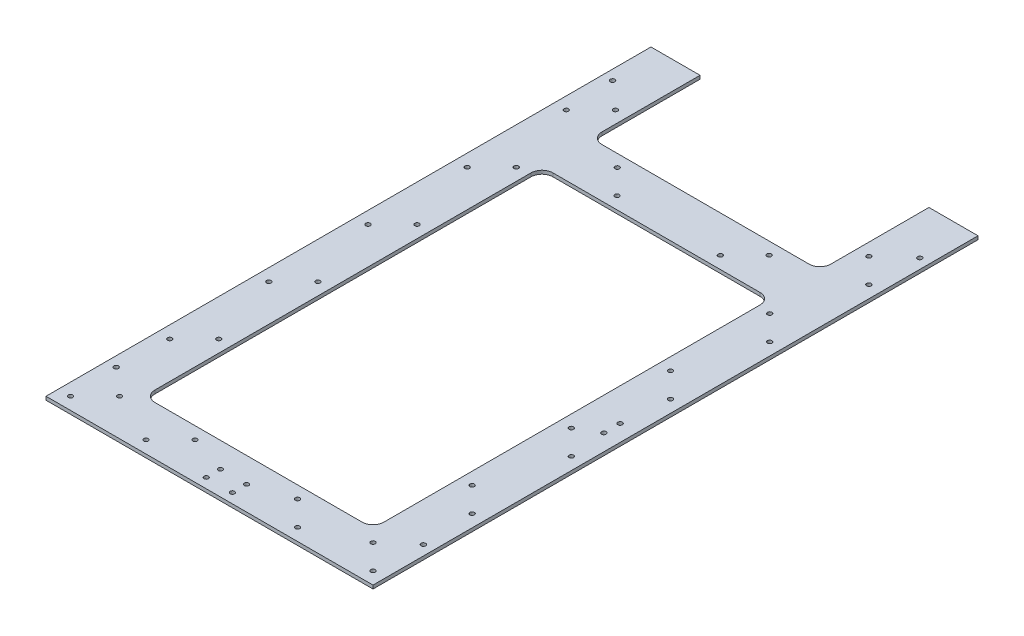
from build123d import *

# Parameters (mm, degrees)
SKETCH1_W           = 300
SKETCH1_H           = 600
BOSS_EXTRUDE1_DEPTH = 3.175
CUT_EXTRUDE1_DEPTH  = 10
SKETCH4_R           = 2.05
CUT_EXTRUDE2_DEPTH  = 51
SKETCH5_R           = 2.1
CUT_EXTRUDE3_DEPTH  = 67
SKETCH7_R           = 2.05
CUT_EXTRUDE4_DEPTH  = 10
SKETCH8_R           = 2.1
CUT_EXTRUDE5_DEPTH  = 10


with BuildPart() as part:
    # Sketch1 → Boss-Extrude1 (new body)
    with BuildSketch(Plane(origin=(0, 0, 0), x_dir=(1, 0, 0), z_dir=(0, 1, 0))):
        Rectangle(SKETCH1_W, SKETCH1_H)
    extrude(amount=BOSS_EXTRUDE1_DEPTH)

    # Sketch3 → Cut-Extrude1 (cut)
    with BuildSketch(Plane(origin=(0, 3.175, 0), x_dir=(1, 0, 0), z_dir=(0, 1, 0))):
        with BuildLine():
            Line((-95, -255), (95, -255))
            ThreePointArc((95, -255), (102.071067812, -252.071067812), (105, -245))
            Line((105, -245), (105, 100))
            ThreePointArc((105, 100), (102.071067812, 107.071067812), (95, 110))
            Line((95, 110), (-95, 110))
            ThreePointArc((-95, 110), (-102.071067812, 107.071067812), (-105, 100))
            Line((-105, 100), (-105, -245))
            ThreePointArc((-105, -245), (-102.071067812, -252.071067812), (-95, -255))
        make_face()
        with BuildLine():
            Line((105, 255), (105, 165))
            ThreePointArc((105, 165), (102.071067812, 157.928932188), (95, 155))
            Line((95, 155), (-95, 155))
            ThreePointArc((-95, 155), (-102.071067992, 157.928932157), (-105.000000511, 165))
            Line((-105.000000511, 165), (-105.000005107, 255))
            Line((-105.000005107, 255), (-150, 255))
            Line((-150, 255), (-150, 300))
            Line((-150, 300), (150, 300))
            Line((150, 300), (150, 255))
            Line((150, 255), (105, 255))
        make_face()
    extrude(amount=-CUT_EXTRUDE1_DEPTH, mode=Mode.SUBTRACT)

    # Sketch4 → Cut-Extrude2 (cut)
    with BuildSketch(Plane(origin=(0, 3.175, 0), x_dir=(1, 0, 0), z_dir=(0, 1, 0))):
        with Locations((12, -291)):
            Circle(SKETCH4_R)
        with Locations((-12, -291)):
            Circle(SKETCH4_R)
        with Locations((-12, -278)):
            Circle(SKETCH4_R)
        with Locations((12, -278)):
            Circle(SKETCH4_R)
    extrude(amount=-CUT_EXTRUDE2_DEPTH, mode=Mode.SUBTRACT)

    # Sketch5 → Cut-Extrude3 (cut)
    with BuildSketch(Plane(origin=(0, 3.175, 0), x_dir=(1, 0, 0), z_dir=(0, 1, 0))):
        with Locations((135, -73.264775169)):
            Circle(SKETCH5_R)
        with Locations((135, -58.264775169)):
            Circle(SKETCH5_R)
    extrude(amount=-CUT_EXTRUDE3_DEPTH, mode=Mode.SUBTRACT)

    # Sketch7 → Cut-Extrude4 (cut)
    with BuildSketch(Plane(origin=(0, 3.175, 0), x_dir=(1, 0, 0), z_dir=(0, 1, 0))):
        with Locations((138.75, -288.75)):
            Circle(SKETCH7_R)
        with Locations((116.25, -266.25)):
            Circle(SKETCH7_R)
        with Locations((47.023601507, -266.25)):
            Circle(SKETCH7_R)
        with Locations((69.523601507, -288.75)):
            Circle(SKETCH7_R)
        with Locations((116.25, -175.280895489)):
            Circle(SKETCH7_R)
        with Locations((138.75, -197.780895489)):
            Circle(SKETCH7_R)
        with Locations((116.25, -84.311790979)):
            Circle(SKETCH7_R)
        with Locations((138.75, -106.811790979)):
            Circle(SKETCH7_R)
        with Locations((116.25, 6.657313532)):
            Circle(SKETCH7_R)
        with Locations((138.75, -15.842686468)):
            Circle(SKETCH7_R)
        with Locations((116.25, 97.626418043)):
            Circle(SKETCH7_R)
        with Locations((138.75, 75.126418043)):
            Circle(SKETCH7_R)
        with Locations((116.25, 188.595522553)):
            Circle(SKETCH7_R)
        with Locations((138.75, 166.095522553)):
            Circle(SKETCH7_R)
        with Locations((138.75, 257.064627064)):
            Circle(SKETCH7_R)
        with Locations((47.357849803, 121.25)):
            Circle(SKETCH7_R)
        with Locations((69.635017605, 143.75)):
            Circle(SKETCH7_R)
        with Locations((-47.357849803, 121.25)):
            Circle(SKETCH7_R)
        with Locations((-69.635017605, 143.75)):
            Circle(SKETCH7_R)
        with Locations((-138.75, 257.064627064)):
            Circle(SKETCH7_R)
        with Locations((-116.25, 188.595522553)):
            Circle(SKETCH7_R)
        with Locations((-138.75, 166.095522553)):
            Circle(SKETCH7_R)
        with Locations((-138.75, 75.126418043)):
            Circle(SKETCH7_R)
        with Locations((-116.25, 6.657313532)):
            Circle(SKETCH7_R)
        with Locations((-116.25, 97.626418043)):
            Circle(SKETCH7_R)
        with Locations((-116.25, -84.311790979)):
            Circle(SKETCH7_R)
        with Locations((-138.75, -15.842686468)):
            Circle(SKETCH7_R)
        with Locations((-138.75, -106.811790979)):
            Circle(SKETCH7_R)
        with Locations((-116.25, -175.280895489)):
            Circle(SKETCH7_R)
        with Locations((-138.75, -197.780895489)):
            Circle(SKETCH7_R)
        with Locations((-116.25, -266.25)):
            Circle(SKETCH7_R)
        with Locations((-138.75, -288.75)):
            Circle(SKETCH7_R)
        with Locations((-47.023601507, -266.25)):
            Circle(SKETCH7_R)
        with Locations((-69.523601507, -288.75)):
            Circle(SKETCH7_R)
    extrude(amount=-CUT_EXTRUDE4_DEPTH, mode=Mode.SUBTRACT)

    # Sketch8 → Cut-Extrude5 (cut)
    with BuildSketch(Plane(origin=(0, 3.175, 0), x_dir=(1, 0, 0), z_dir=(0, 1, 0))):
        with Locations((140.932258065, 210.665995932)):
            Circle(SKETCH8_R)
        with Locations((140.932258065, -244.725676292)):
            Circle(SKETCH8_R)
    cut_extrude5 = extrude(amount=-CUT_EXTRUDE5_DEPTH, mode=Mode.SUBTRACT)

    # Mirror1: Cut-Extrude5 across plane
    add(cut_extrude5.mirror(Plane(origin=(0, 0, 0), x_dir=(0, 0, 1), z_dir=(1, 0, 0))), mode=Mode.SUBTRACT)


solid = part.part
